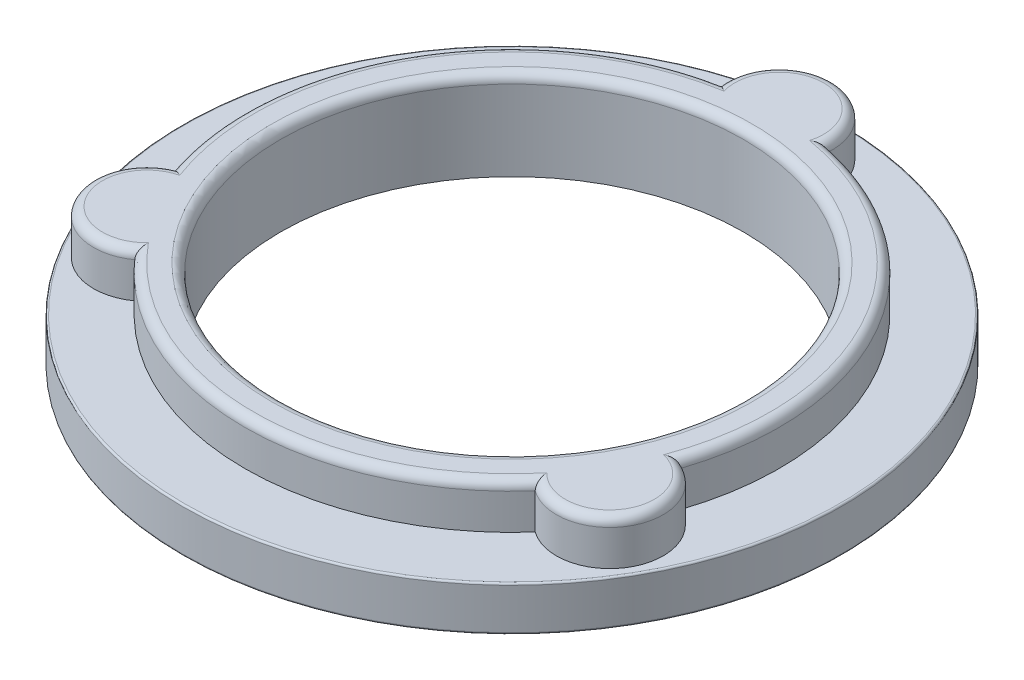
from build123d import *

# Parameters (mm, degrees)
SKETCH1_R           = 18.5
SKETCH1_R_2         = 13
BOSS_EXTRUDE1_DEPTH = 2.5
SKETCH3_R           = 13
BOSS_EXTRUDE2_DEPTH = 2.5
FILLET1_R           = 0.5
FILLET2_R           = 0.1


with BuildPart() as part:
    # Sketch1 → Boss-Extrude1 (new body)
    with BuildSketch(Plane(origin=(0, 0, 0), x_dir=(1, 0, 0), z_dir=(0, 1, 0))):
        Circle(SKETCH1_R)
        Circle(SKETCH1_R_2, mode=Mode.SUBTRACT)
    extrude(amount=BOSS_EXTRUDE1_DEPTH)

    # Sketch3 → Boss-Extrude2 (add)
    with BuildSketch(Plane(origin=(0, 2.5, 0), x_dir=(1, 0, 0), z_dir=(0, 1, 0))):
        with BuildLine():
            ThreePointArc((14.223054591, -4.764946809), (12.990381057, 7.5), (2.984962311, 14.7))
            ThreePointArc((2.984962311, 14.7), (0, 18), (-2.984962311, 14.7))
            ThreePointArc((-2.984962311, 14.7), (-12.990381057, 7.5), (-14.223054591, -4.764946809))
            ThreePointArc((-14.223054591, -4.764946809), (-15.588457268, -9), (-11.23809228, -9.935053191))
            ThreePointArc((-11.23809228, -9.935053191), (0, -15), (11.23809228, -9.935053191))
            ThreePointArc((11.23809228, -9.935053191), (15.588457268, -9), (14.223054591, -4.764946809))
        make_face()
        Circle(SKETCH3_R, mode=Mode.SUBTRACT)
    extrude(amount=BOSS_EXTRUDE2_DEPTH)

    # Fillet1
    fillet1_edges = [part.edges().sort_by_distance(p)[0] for p in [
        (-15.588457268, 5, 9),
        (-12.990381057, 5, -7.5),
        (0, 5, -18),
        (12.990381057, 5, -7.5),
        (15.588457268, 5, 9),
        (0, 5, 15),
        (-13, 5, 0),
    ]]
    fillet(fillet1_edges, radius=FILLET1_R)

    # Fillet2
    fillet2_edges = [part.edges().sort_by_distance(p)[0] for p in [
        (-18.5, 0, 0),
        (-18.5, 2.5, 0),
    ]]
    fillet(fillet2_edges, radius=FILLET2_R)


solid = part.part
